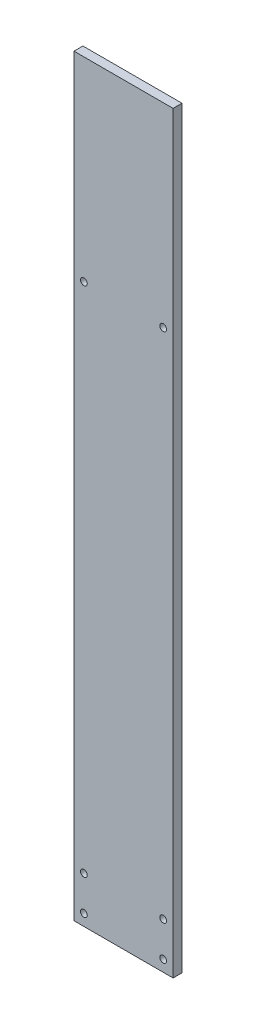
from build123d import *

# Parameters (mm, degrees)
SKETCH1_W           = 100
SKETCH1_H           = 760
BOSS_EXTRUDE1_DEPTH = 9
M8_TAPPED_HOLE_D    = 6.8


with BuildPart() as part:
    # Sketch1 → Boss-Extrude1 (new body)
    with BuildSketch(Plane.XY):
        with Locations((-180.300605602, -198.433128803)):
            Rectangle(SKETCH1_W, SKETCH1_H)
    extrude(amount=BOSS_EXTRUDE1_DEPTH)

    # M8 Tapped Hole (through all)
    with Locations(Plane(origin=(-171.596169666, -73.097017265, 9), x_dir=(1, 0, 0), z_dir=(0, 0, 1))):
        with Locations((-48.704435936, -458.836111538), (-48.704435936, -493.836111538), (31.295564064, -493.836111538), (31.295564064, -458.836111538), (31.295564064, 58.078352635), (-48.704435936, 58.078352635)):
            Hole(M8_TAPPED_HOLE_D / 2)


solid = part.part
